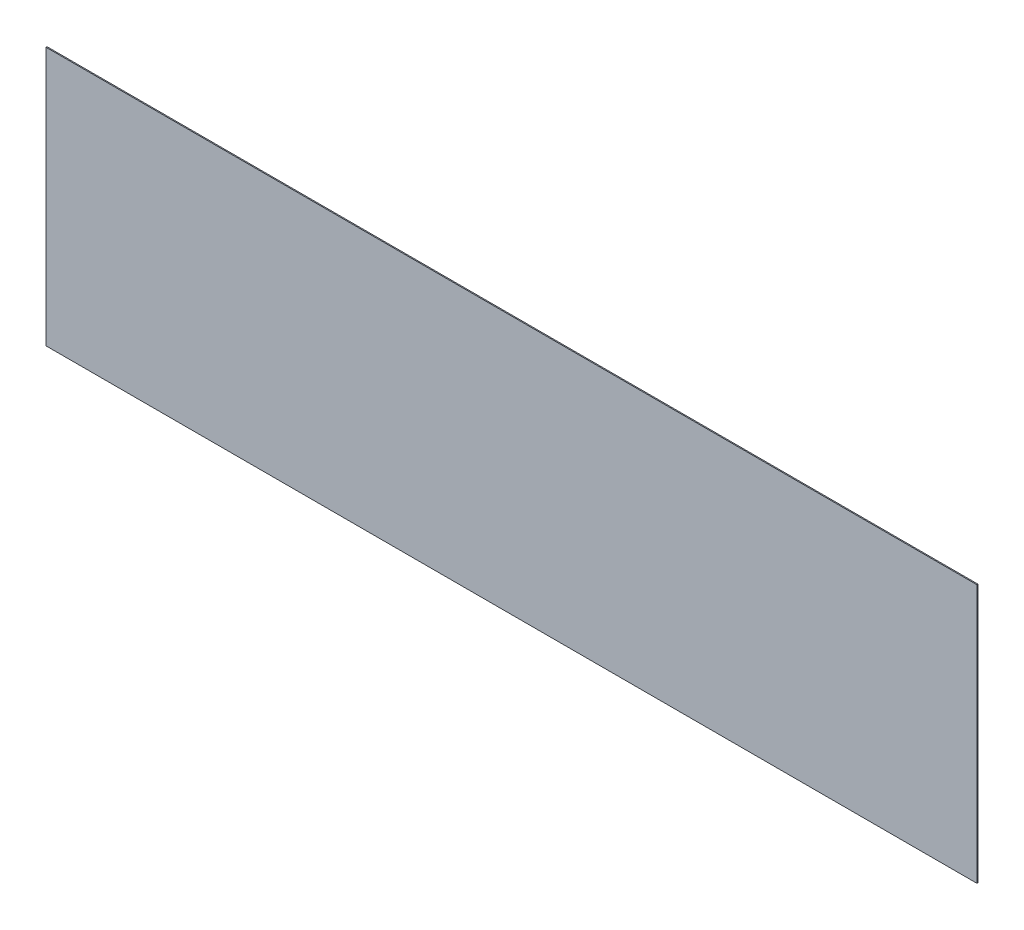
from build123d import *

# Parameters (mm, degrees)
SKETCH1_W          = 1800
SKETCH1_H          = 500
BASE_FLANGE1_DEPTH = 2


# Sheet-metal steps are written as plain solids
with BuildPart() as part:
    # Sketch1 → Base-Flange1 (new body)
    with BuildSketch(Plane.XY):
        Rectangle(SKETCH1_W, SKETCH1_H)
    extrude(amount=-BASE_FLANGE1_DEPTH)


solid = part.part
